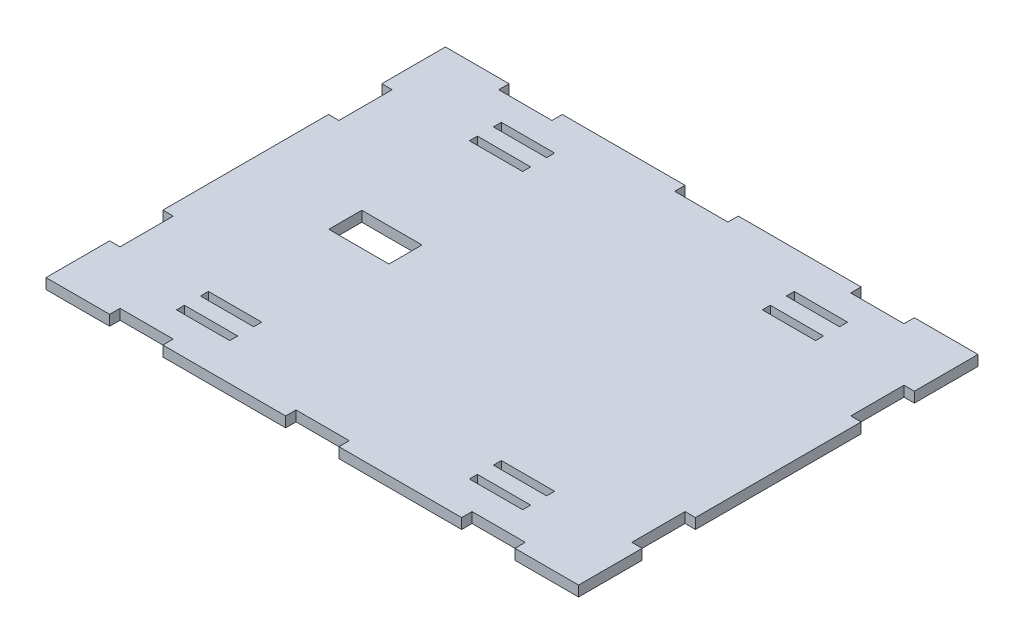
from build123d import *

# Parameters (mm, degrees)
SKETCH1_W           = 20
SKETCH1_H           = 3
SKETCH1_W_2         = 22.6
SKETCH1_H_2         = 12.4
BOSS_EXTRUDE1_DEPTH = 3.9


with BuildPart() as part:
    # Sketch1 → Boss-Extrude1 (new body)
    with BuildSketch(Plane(origin=(0, 0, 0), x_dir=(1, 0, 0), z_dir=(0, 1, 0))):
        Polygon((-100, 75), (-76.1, 75), (-76.1, 71.1), (-56.1, 71.1), (-56.1, 75), (-10, 75), (-10, 71.1), (10, 71.1), (10, 75), (56.1, 75), (56.1, 71.1), (76.1, 71.1), (76.1, 75), (100, 75), (100, 51.1), (96.1, 51.1), (96.1, 31.1), (100, 31.1), (100, -31.1), (96.1, -31.1), (96.1, -51.1), (100, -51.1), (100, -75), (76.1, -75), (76.1, -71.1), (56.1, -71.1), (56.1, -75), (10, -75), (10, -71.1), (-10, -71.1), (-10, -75), (-56.1, -75), (-56.1, -71.1), (-76.1, -71.1), (-76.1, -75), (-100, -75), (-100, -51.1), (-96.1, -51.1), (-96.1, -31.1), (-100, -31.1), (-100, 31.1), (-96.1, 31.1), (-96.1, 51.1), (-100, 51.1), align=None)
        with Locations((-55, -50.5)):
            Rectangle(SKETCH1_W, SKETCH1_H, mode=Mode.SUBTRACT)
        with Locations((-55, -59.5)):
            Rectangle(SKETCH1_W, SKETCH1_H, mode=Mode.SUBTRACT)
        with Locations((55, -59.5)):
            Rectangle(SKETCH1_W, SKETCH1_H, mode=Mode.SUBTRACT)
        with Locations((55, -50.5)):
            Rectangle(SKETCH1_W, SKETCH1_H, mode=Mode.SUBTRACT)
        with Locations((55, 50.5)):
            Rectangle(SKETCH1_W, SKETCH1_H, mode=Mode.SUBTRACT)
        with Locations((55, 59.5)):
            Rectangle(SKETCH1_W, SKETCH1_H, mode=Mode.SUBTRACT)
        with Locations((-55, 59.5)):
            Rectangle(SKETCH1_W, SKETCH1_H, mode=Mode.SUBTRACT)
        with Locations((-55, 50.5)):
            Rectangle(SKETCH1_W, SKETCH1_H, mode=Mode.SUBTRACT)
        with Locations((-51.3, 0)):
            Rectangle(SKETCH1_W_2, SKETCH1_H_2, mode=Mode.SUBTRACT)
    extrude(amount=BOSS_EXTRUDE1_DEPTH)


solid = part.part
